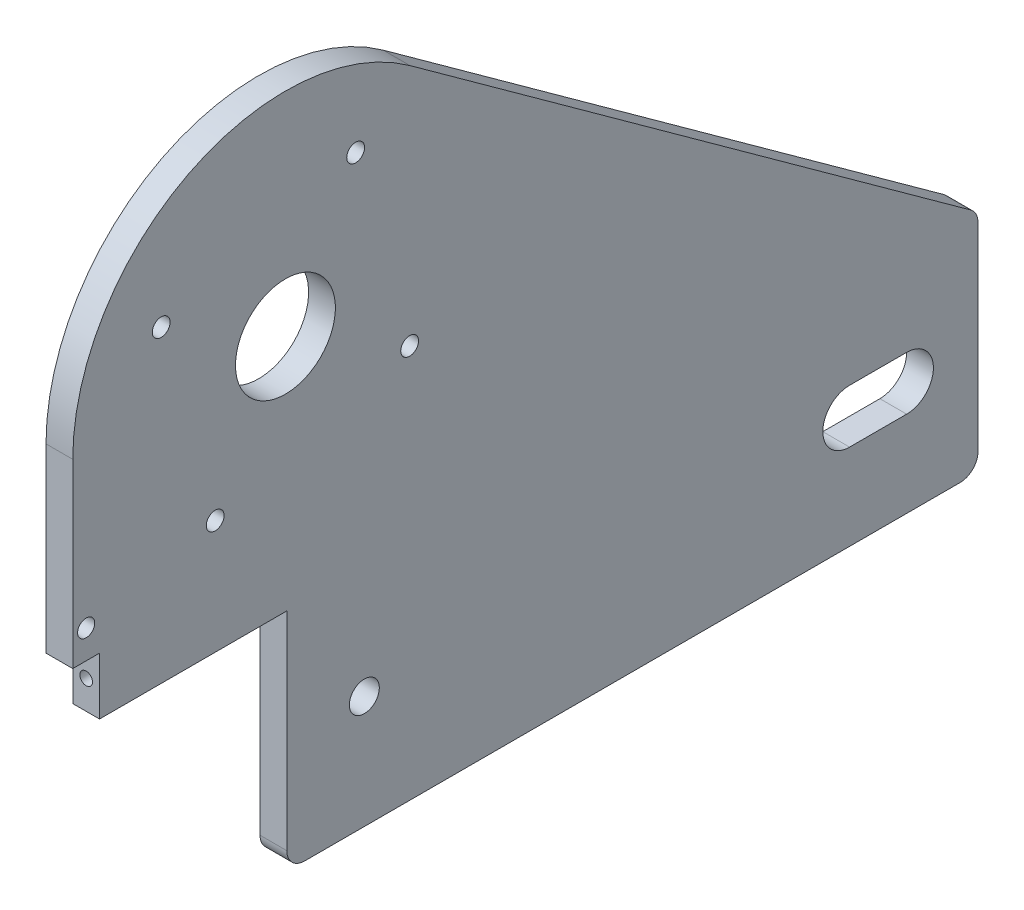
from build123d import *

# Parameters (mm, degrees)
SKETCH1_R           = 1.5875
SKETCH1_R_2         = 2.667
SKETCH1_R_3         = 1.524
SKETCH1_R_4         = 8.89
BOSS_EXTRUDE1_DEPTH = 4.7625
SKETCH2_R           = 1.1303
CUT_EXTRUDE1_DEPTH  = 6.35


with BuildPart() as part:
    # Sketch1 → Boss-Extrude1 (new body)
    with BuildSketch(Plane(origin=(0, 0, 0), x_dir=(0, 0, -1), z_dir=(1, 0, 0))):
        with BuildLine():
            Line((-39.282795117, 0), (77.382795117, 0))
            ThreePointArc((77.382795117, 0), (79.627859148, 0.92993597), (80.557795117, 3.175))
            Line((80.557795117, 3.175), (80.557795117, 38.509654789))
            ThreePointArc((80.557795117, 38.509654789), (80.210081315, 39.954326985), (79.243100468, 41.082569284))
            Line((79.243100468, 41.082569284), (-20.530611645, 113.222382255))
            ThreePointArc((-20.530611645, 113.222382255), (-59.930107761, 116.254813413), (-80.557795117, 82.55))
            Line((-80.557795117, 82.55), (-80.557795117, 50.292))
            Line((-80.557795117, 50.292), (-75.795295117, 50.292))
            Line((-75.795295117, 50.292), (-75.795295117, 40.132))
            Line((-75.795295117, 40.132), (-42.457795117, 40.132))
            Line((-42.457795117, 40.132), (-42.457795117, 3.175))
            ThreePointArc((-42.457795117, 3.175), (-41.527859148, 0.92993597), (-39.282795117, 0))
        make_face()
        with Locations((-55.209041359, 60.43939525)):
            Circle(SKETCH1_R, mode=Mode.SUBTRACT)
        with Locations((-28.662204883, 20.066)):
            Circle(SKETCH1_R_2, mode=Mode.SUBTRACT)
        with Locations((-20.597190367, 70.048753759)):
            Circle(SKETCH1_R, mode=Mode.SUBTRACT)
        with Locations((-64.818399868, 95.051246241)):
            Circle(SKETCH1_R, mode=Mode.SUBTRACT)
        with Locations((-30.206548876, 104.66060475)):
            Circle(SKETCH1_R, mode=Mode.SUBTRACT)
        with Locations((-78.176545117, 55.372)):
            Circle(SKETCH1_R_3, mode=Mode.SUBTRACT)
        with Locations((-42.707795117, 82.55)):
            Circle(SKETCH1_R_4, mode=Mode.SUBTRACT)
        with BuildLine():
            Line((67.857795117, 15.3035), (57.697795117, 15.3035))
            ThreePointArc((57.697795117, 15.3035), (52.935295117, 20.066), (57.697795117, 24.8285))
            Line((57.697795117, 24.8285), (67.857795117, 24.8285))
            ThreePointArc((67.857795117, 24.8285), (72.620295117, 20.066), (67.857795117, 15.3035))
        make_face(mode=Mode.SUBTRACT)
    extrude(amount=BOSS_EXTRUDE1_DEPTH)

    # Sketch2 → Cut-Extrude1 (cut)
    with BuildSketch(Plane.XY.offset(75.795295117)):
        with Locations((2.38125, 45.212)):
            Circle(SKETCH2_R)
    extrude(amount=-CUT_EXTRUDE1_DEPTH, mode=Mode.SUBTRACT)


solid = part.part
